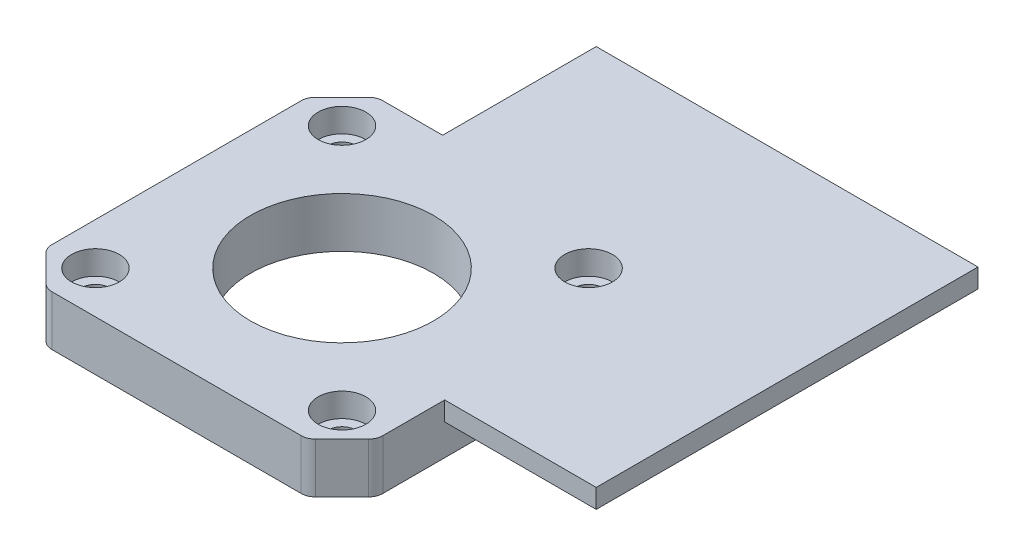
from build123d import *

# Parameters (mm, degrees)
SKETCH1_R                 = 3
SKETCH1_R_2               = 11.5
SKETCH1_R_3               = 1.75
BOSS_EXTRUDE1_DEPTH       = 3.9
BOSS_EXTRUDE2_START       = 3.9
SKETCH1_3_R               = 11.5
SKETCH1_3_R_2             = 2.55
SKETCH1_3_R_3             = 1.75
BOSS_EXTRUDE2_DEPTH       = 1.8
BOSS_EXTRUDE3_START       = 5.7
BOSS_EXTRUDE3_OUTLINE_R   = 1.75
BOSS_EXTRUDE3_OUTLINE_R_2 = 11.5
BOSS_EXTRUDE3_DEPTH       = 0.6
CUT_EXTRUDE1_START        = 3.3
SKETCH1_5_R               = 3
SKETCH1_5_R_2             = 1.75
CUT_EXTRUDE1_DEPTH        = 3


# Read off the part's stored shape, not the designer's step: Boss-Extrude3
with BuildPart() as part:
    # Sketch1 → Boss-Extrude1 (new body)
    # profile 1 of 8: a face of its own
    with BuildSketch(Plane(origin=(0, -49.230927878, 0), x_dir=(1, 0, 0), z_dir=(0, 1, 0))):
        with BuildLine():
            ThreePointArc((189.95960286, -204.382792206), (190.543564888, -204.772983159), (191.232395066, -204.91))
            Line((191.232395066, -204.91), (222.575540816, -204.91))
            ThreePointArc((222.575540816, -204.91), (223.264370995, -204.772983159), (223.848333022, -204.382792206))
            Line((223.848333022, -204.382792206), (227.176760147, -201.054365081))
            ThreePointArc((227.176760147, -201.054365081), (227.5669511, -200.470403054), (227.703967941, -199.781572875))
            Line((227.703967941, -199.781572875), (227.703967941, -192))
            Line((227.703967941, -192), (227.703967941, -168.438427125))
            ThreePointArc((227.703967941, -168.438427125), (227.5669511, -167.749596946), (227.176760147, -167.165634919))
            Line((227.176760147, -167.165634919), (223.848333022, -163.837207794))
            ThreePointArc((223.848333022, -163.837207794), (223.264370995, -163.447016841), (222.575540816, -163.31))
            Line((222.575540816, -163.31), (198.753967941, -163.31))
            Line((198.753967941, -163.31), (191.232395066, -163.31))
            ThreePointArc((191.232395066, -163.31), (190.543564888, -163.447016841), (189.95960286, -163.837207794))
            Line((189.95960286, -163.837207794), (186.631175735, -167.165634919))
            ThreePointArc((186.631175735, -167.165634919), (186.240984783, -167.749596946), (186.103967941, -168.438427125))
            Line((186.103967941, -168.438427125), (186.103967941, -199.781572875))
            ThreePointArc((186.103967941, -199.781572875), (186.240984783, -200.470403054), (186.631175735, -201.054365081))
            Line((186.631175735, -201.054365081), (189.95960286, -204.382792206))
        make_face()
        with Locations((191.403967941, -199.61)):
            Circle(SKETCH1_R, mode=Mode.SUBTRACT)
        with Locations(Location((206.903967941, -184.11, 0), (0, 0, 90))):
            Circle(SKETCH1_R_2, mode=Mode.SUBTRACT)
        with Locations((222.403967941, -199.61)):
            Circle(SKETCH1_R, mode=Mode.SUBTRACT)
        with Locations((191.403967941, -168.61)):
            Circle(SKETCH1_R, mode=Mode.SUBTRACT)
        with Locations((222.403967941, -168.61)):
            Circle(SKETCH1_R, mode=Mode.SUBTRACT)
    # profile 2 of 8: a face of its own
    with BuildSketch(Plane(origin=(0, -49.230927878, 0), x_dir=(1, 0, 0), z_dir=(0, 1, 0))):
        with BuildLine():
            ThreePointArc((189.95960286, -204.382792206), (190.543564888, -204.772983159), (191.232395066, -204.91))
            Line((191.232395066, -204.91), (222.575540816, -204.91))
            ThreePointArc((222.575540816, -204.91), (223.264370995, -204.772983159), (223.848333022, -204.382792206))
            Line((223.848333022, -204.382792206), (227.176760147, -201.054365081))
            ThreePointArc((227.176760147, -201.054365081), (227.5669511, -200.470403054), (227.703967941, -199.781572875))
            Line((227.703967941, -199.781572875), (227.703967941, -192))
            Line((227.703967941, -192), (227.703967941, -168.438427125))
            ThreePointArc((227.703967941, -168.438427125), (227.5669511, -167.749596946), (227.176760147, -167.165634919))
            Line((227.176760147, -167.165634919), (223.848333022, -163.837207794))
            ThreePointArc((223.848333022, -163.837207794), (223.264370995, -163.447016841), (222.575540816, -163.31))
            Line((222.575540816, -163.31), (198.753967941, -163.31))
            Line((198.753967941, -163.31), (191.232395066, -163.31))
            ThreePointArc((191.232395066, -163.31), (190.543564888, -163.447016841), (189.95960286, -163.837207794))
            Line((189.95960286, -163.837207794), (186.631175735, -167.165634919))
            ThreePointArc((186.631175735, -167.165634919), (186.240984783, -167.749596946), (186.103967941, -168.438427125))
            Line((186.103967941, -168.438427125), (186.103967941, -199.781572875))
            ThreePointArc((186.103967941, -199.781572875), (186.240984783, -200.470403054), (186.631175735, -201.054365081))
            Line((186.631175735, -201.054365081), (189.95960286, -204.382792206))
        make_face()
        with Locations((191.403967941, -199.61)):
            Circle(SKETCH1_R, mode=Mode.SUBTRACT)
        with Locations(Location((206.903967941, -184.11, 0), (0, 0, 90))):
            Circle(SKETCH1_R_2, mode=Mode.SUBTRACT)
        with Locations((222.403967941, -199.61)):
            Circle(SKETCH1_R, mode=Mode.SUBTRACT)
        with Locations((191.403967941, -168.61)):
            Circle(SKETCH1_R, mode=Mode.SUBTRACT)
        with Locations((222.403967941, -168.61)):
            Circle(SKETCH1_R, mode=Mode.SUBTRACT)
    # profile 3 of 8: a face of its own
    with BuildSketch(Plane(origin=(0, -49.230927878, 0), x_dir=(1, 0, 0), z_dir=(0, 1, 0))):
        with Locations((191.403967941, -168.61)):
            Circle(SKETCH1_R)
        with Locations(Location((191.403967941, -168.61, 0), (0, 0, 90))):
            Circle(SKETCH1_R_3, mode=Mode.SUBTRACT)
    # profile 4 of 8: a face of its own
    with BuildSketch(Plane(origin=(0, -49.230927878, 0), x_dir=(1, 0, 0), z_dir=(0, 1, 0))):
        with Locations((222.403967941, -168.61)):
            Circle(SKETCH1_R)
        with Locations(Location((222.403967941, -168.61, 0), (0, 0, 90))):
            Circle(SKETCH1_R_3, mode=Mode.SUBTRACT)
    # profile 5 of 8: a face of its own
    with BuildSketch(Plane(origin=(0, -49.230927878, 0), x_dir=(1, 0, 0), z_dir=(0, 1, 0))):
        with Locations((222.403967941, -199.61)):
            Circle(SKETCH1_R)
        with Locations(Location((222.403967941, -199.61, 0), (0, 0, 90))):
            Circle(SKETCH1_R_3, mode=Mode.SUBTRACT)
    # profile 6 of 8: a face of its own
    with BuildSketch(Plane(origin=(0, -49.230927878, 0), x_dir=(1, 0, 0), z_dir=(0, 1, 0))):
        with Locations((191.403967941, -199.61)):
            Circle(SKETCH1_R)
        with Locations(Location((191.403967941, -199.61, 0), (0, 0, 90))):
            Circle(SKETCH1_R_3, mode=Mode.SUBTRACT)
    # profile 7 of 8: a face of its own
    with BuildSketch(Plane(origin=(0, -49.230927878, 0), x_dir=(1, 0, 0), z_dir=(0, 1, 0))):
        with Locations((191.403967941, -168.61)):
            Circle(SKETCH1_R)
        with Locations(Location((191.403967941, -168.61, 0), (0, 0, 90))):
            Circle(SKETCH1_R_3, mode=Mode.SUBTRACT)
    # profile 8 of 8: a face of its own
    with BuildSketch(Plane(origin=(0, -49.230927878, 0), x_dir=(1, 0, 0), z_dir=(0, 1, 0))):
        with Locations((222.403967941, -168.61)):
            Circle(SKETCH1_R)
        with Locations(Location((222.403967941, -168.61, 0), (0, 0, 90))):
            Circle(SKETCH1_R_3, mode=Mode.SUBTRACT)
    extrude(amount=BOSS_EXTRUDE1_DEPTH)

    # Sketch1<3> → Boss-Extrude2 (add)
    with BuildSketch(Plane(origin=(0, -49.230927878, 0), x_dir=(1, 0, 0), z_dir=(0, 1, 0)).offset(BOSS_EXTRUDE2_START)):
        with BuildLine():
            ThreePointArc((189.95960286, -204.382792206), (190.543564888, -204.772983159), (191.232395066, -204.91))
            Line((191.232395066, -204.91), (222.575540816, -204.91))
            ThreePointArc((222.575540816, -204.91), (223.264370995, -204.772983159), (223.848333022, -204.382792206))
            Line((223.848333022, -204.382792206), (227.176760147, -201.054365081))
            ThreePointArc((227.176760147, -201.054365081), (227.5669511, -200.470403054), (227.703967941, -199.781572875))
            Line((227.703967941, -199.781572875), (227.703967941, -192))
            Line((227.703967941, -192), (246.753967941, -192))
            Line((246.753967941, -192), (246.753967941, -144))
            Line((246.753967941, -144), (198.753967941, -144))
            Line((198.753967941, -144), (198.753967941, -163.31))
            Line((198.753967941, -163.31), (191.232395066, -163.31))
            ThreePointArc((191.232395066, -163.31), (190.543564888, -163.447016841), (189.95960286, -163.837207794))
            Line((189.95960286, -163.837207794), (186.631175735, -167.165634919))
            ThreePointArc((186.631175735, -167.165634919), (186.240984783, -167.749596946), (186.103967941, -168.438427125))
            Line((186.103967941, -168.438427125), (186.103967941, -199.781572875))
            ThreePointArc((186.103967941, -199.781572875), (186.240984783, -200.470403054), (186.631175735, -201.054365081))
            Line((186.631175735, -201.054365081), (189.95960286, -204.382792206))
        make_face()
        with Locations(Location((206.903967941, -184.11, 0), (0, 0, 90))):
            Circle(SKETCH1_3_R, mode=Mode.SUBTRACT)
        with Locations(Location((242.753967941, -180, 0), (0, 0, 90))):
            Circle(SKETCH1_3_R_2, mode=Mode.SUBTRACT)
        with Locations(Location((234.753967941, -172, 0), (0, 0, 90))):
            Circle(SKETCH1_3_R_2, mode=Mode.SUBTRACT)
        with Locations(Location((242.753967941, -172, 0), (0, 0, 90))):
            Circle(SKETCH1_3_R_2, mode=Mode.SUBTRACT)
        with Locations(Location((234.753967941, -164, 0), (0, 0, 90))):
            Circle(SKETCH1_3_R_2, mode=Mode.SUBTRACT)
        with Locations(Location((242.753967941, -164, 0), (0, 0, 90))):
            Circle(SKETCH1_3_R_2, mode=Mode.SUBTRACT)
        with Locations(Location((234.753967941, -188, 0), (0, 0, 90))):
            Circle(SKETCH1_3_R_2, mode=Mode.SUBTRACT)
        with Locations(Location((242.753967941, -188, 0), (0, 0, 90))):
            Circle(SKETCH1_3_R_2, mode=Mode.SUBTRACT)
        with Locations(Location((234.753967941, -180, 0), (0, 0, 90))):
            Circle(SKETCH1_3_R_2, mode=Mode.SUBTRACT)
        with Locations(Location((242.753967941, -148, 0), (0, 0, 90))):
            Circle(SKETCH1_3_R_2, mode=Mode.SUBTRACT)
        with Locations(Location((202.753967941, -156, 0), (0, 0, 90))):
            Circle(SKETCH1_3_R_2, mode=Mode.SUBTRACT)
        with Locations(Location((210.753967941, -156, 0), (0, 0, 90))):
            Circle(SKETCH1_3_R_2, mode=Mode.SUBTRACT)
        with Locations(Location((202.753967941, -148, 0), (0, 0, 90))):
            Circle(SKETCH1_3_R_2, mode=Mode.SUBTRACT)
        with Locations(Location((210.753967941, -148, 0), (0, 0, 90))):
            Circle(SKETCH1_3_R_2, mode=Mode.SUBTRACT)
        with Locations(Location((218.753967941, -156, 0), (0, 0, 90))):
            Circle(SKETCH1_3_R_2, mode=Mode.SUBTRACT)
        with Locations(Location((226.753967941, -156, 0), (0, 0, 90))):
            Circle(SKETCH1_3_R_2, mode=Mode.SUBTRACT)
        with Locations(Location((218.753967941, -148, 0), (0, 0, 90))):
            Circle(SKETCH1_3_R_2, mode=Mode.SUBTRACT)
        with Locations(Location((226.753967941, -148, 0), (0, 0, 90))):
            Circle(SKETCH1_3_R_2, mode=Mode.SUBTRACT)
        with Locations(Location((234.753967941, -156, 0), (0, 0, 90))):
            Circle(SKETCH1_3_R_2, mode=Mode.SUBTRACT)
        with Locations(Location((242.753967941, -156, 0), (0, 0, 90))):
            Circle(SKETCH1_3_R_2, mode=Mode.SUBTRACT)
        with Locations(Location((234.753967941, -148, 0), (0, 0, 90))):
            Circle(SKETCH1_3_R_2, mode=Mode.SUBTRACT)
        with Locations(Location((191.403967941, -168.61, 0), (0, 0, 90))):
            Circle(SKETCH1_3_R_3, mode=Mode.SUBTRACT)
        with Locations(Location((191.403967941, -199.61, 0), (0, 0, 90))):
            Circle(SKETCH1_3_R_3, mode=Mode.SUBTRACT)
        with Locations(Location((222.403967941, -199.61, 0), (0, 0, 90))):
            Circle(SKETCH1_3_R_3, mode=Mode.SUBTRACT)
        with Locations(Location((222.403967941, -168.61, 0), (0, 0, 90))):
            Circle(SKETCH1_3_R_3, mode=Mode.SUBTRACT)
    extrude(amount=BOSS_EXTRUDE2_DEPTH)

    # Boss-Extrude3 outline → Boss-Extrude3 (add)
    with BuildSketch(Plane(origin=(0, -49.230927878, 0), x_dir=(1, 0, 0), z_dir=(0, 1, 0)).offset(BOSS_EXTRUDE3_START)):
        with BuildLine():
            ThreePointArc((189.95960286, -204.382792206), (190.543564888, -204.772983159), (191.232395066, -204.91))
            Line((191.232395066, -204.91), (222.575540816, -204.91))
            ThreePointArc((222.575540816, -204.91), (223.264370995, -204.772983159), (223.848333022, -204.382792206))
            Line((223.848333022, -204.382792206), (227.176760147, -201.054365081))
            ThreePointArc((227.176760147, -201.054365081), (227.5669511, -200.470403054), (227.703967941, -199.781572875))
            Line((227.703967941, -199.781572875), (227.703967941, -192))
            Line((227.703967941, -192), (246.753967941, -192))
            Line((246.753967941, -192), (246.753967941, -144))
            Line((246.753967941, -144), (198.753967941, -144))
            Line((198.753967941, -144), (198.753967941, -163.31))
            Line((198.753967941, -163.31), (191.232395066, -163.31))
            ThreePointArc((191.232395066, -163.31), (190.543564888, -163.447016841), (189.95960286, -163.837207794))
            Line((189.95960286, -163.837207794), (186.631175735, -167.165634919))
            ThreePointArc((186.631175735, -167.165634919), (186.240984783, -167.749596947), (186.103967941, -168.438427125))
            Line((186.103967941, -168.438427125), (186.103967941, -199.781572875))
            ThreePointArc((186.103967941, -199.781572875), (186.240984783, -200.470403053), (186.631175735, -201.054365081))
            Line((186.631175735, -201.054365081), (189.95960286, -204.382792206))
        make_face()
        with Locations((191.403967941, -199.61)):
            Circle(BOSS_EXTRUDE3_OUTLINE_R, mode=Mode.SUBTRACT)
        with Locations((206.903967941, -184.11)):
            Circle(BOSS_EXTRUDE3_OUTLINE_R_2, mode=Mode.SUBTRACT)
        with Locations((222.403967941, -199.61)):
            Circle(BOSS_EXTRUDE3_OUTLINE_R, mode=Mode.SUBTRACT)
        with Locations((191.403967941, -168.61)):
            Circle(BOSS_EXTRUDE3_OUTLINE_R, mode=Mode.SUBTRACT)
        with Locations((222.403967941, -168.61)):
            Circle(BOSS_EXTRUDE3_OUTLINE_R, mode=Mode.SUBTRACT)
    extrude(amount=BOSS_EXTRUDE3_DEPTH)

    # Sketch1<5> → Cut-Extrude1 (cut)
    # profile 1 of 4: a face of its own
    with BuildSketch(Plane(origin=(0, -49.230927878, 0), x_dir=(1, 0, 0), z_dir=(0, 1, 0)).offset(CUT_EXTRUDE1_START)):
        with Locations(Location((191.403967941, -168.61, 0), (0, 0, 90))):
            Circle(SKETCH1_5_R)
        with Locations(Location((191.403967941, -168.61, 0), (0, 0, 90))):
            Circle(SKETCH1_5_R_2, mode=Mode.SUBTRACT)
    # profile 2 of 4: a face of its own
    with BuildSketch(Plane(origin=(0, -49.230927878, 0), x_dir=(1, 0, 0), z_dir=(0, 1, 0)).offset(CUT_EXTRUDE1_START)):
        with Locations(Location((222.403967941, -168.61, 0), (0, 0, 90))):
            Circle(SKETCH1_5_R)
        with Locations(Location((222.403967941, -168.61, 0), (0, 0, 90))):
            Circle(SKETCH1_5_R_2, mode=Mode.SUBTRACT)
    # profile 3 of 4: a face of its own
    with BuildSketch(Plane(origin=(0, -49.230927878, 0), x_dir=(1, 0, 0), z_dir=(0, 1, 0)).offset(CUT_EXTRUDE1_START)):
        with Locations(Location((191.403967941, -199.61, 0), (0, 0, 90))):
            Circle(SKETCH1_5_R)
        with Locations(Location((191.403967941, -199.61, 0), (0, 0, 90))):
            Circle(SKETCH1_5_R_2, mode=Mode.SUBTRACT)
    # profile 4 of 4: a face of its own
    with BuildSketch(Plane(origin=(0, -49.230927878, 0), x_dir=(1, 0, 0), z_dir=(0, 1, 0)).offset(CUT_EXTRUDE1_START)):
        with Locations(Location((222.403967941, -199.61, 0), (0, 0, 90))):
            Circle(SKETCH1_5_R)
        with Locations(Location((222.403967941, -199.61, 0), (0, 0, 90))):
            Circle(SKETCH1_5_R_2, mode=Mode.SUBTRACT)
    extrude(amount=CUT_EXTRUDE1_DEPTH, mode=Mode.SUBTRACT)


solid = part.part
